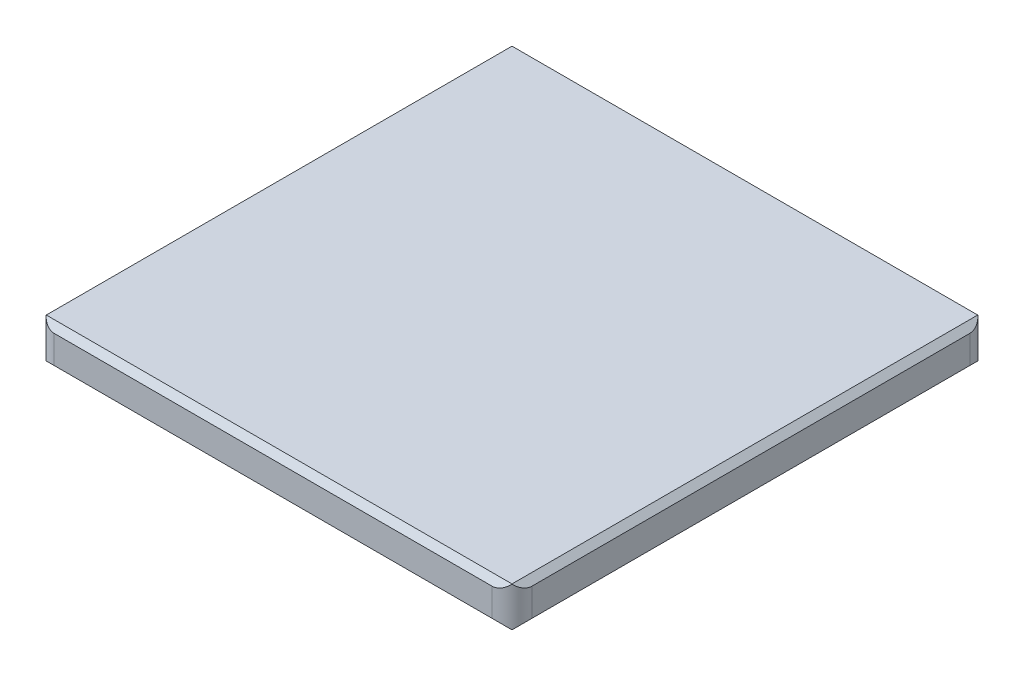
from build123d import *

# Parameters (mm, degrees)
SKETCH1_W           = 304.8
SKETCH1_H           = 304.8
BOSS_EXTRUDE1_DEPTH = 25.4
CHAMFER1_SIZE       = 3.81
CHAMFER2_SIZE       = 3.81
FILLET1_R           = 12.7


with BuildPart() as part:
    # Sketch1 → Boss-Extrude1 (new body)
    with BuildSketch(Plane(origin=(0, 0, 0), x_dir=(1, 0, 0), z_dir=(0, 1, 0))):
        Rectangle(SKETCH1_W, SKETCH1_H)
    extrude(amount=BOSS_EXTRUDE1_DEPTH)

    # Chamfer1
    chamfer1_edges = [part.edges().sort_by_distance(p)[0] for p in [
        (-152.4, 0, 0),
        (0, 0, 152.4),
        (152.4, 0, 0),
        (0, 0, -152.4),
    ]]
    chamfer(chamfer1_edges, length=CHAMFER1_SIZE)

    # Chamfer2
    chamfer2_edges = [part.edges().sort_by_distance(p)[0] for p in [
        (0, 25.4, -152.4),
        (152.4, 25.4, 0),
        (0, 25.4, 152.4),
        (-152.4, 25.4, 0),
    ]]
    chamfer(chamfer2_edges, length=CHAMFER2_SIZE)

    # Fillet1
    fillet1_edges = [part.edges().sort_by_distance(p)[0] for p in [
        (152.4, 12.7, -152.4),
        (152.4, 12.7, 152.4),
        (-152.4, 12.7, 152.4),
        (-152.4, 12.7, -152.4),
    ]]
    fillet(fillet1_edges, radius=FILLET1_R)


solid = part.part
